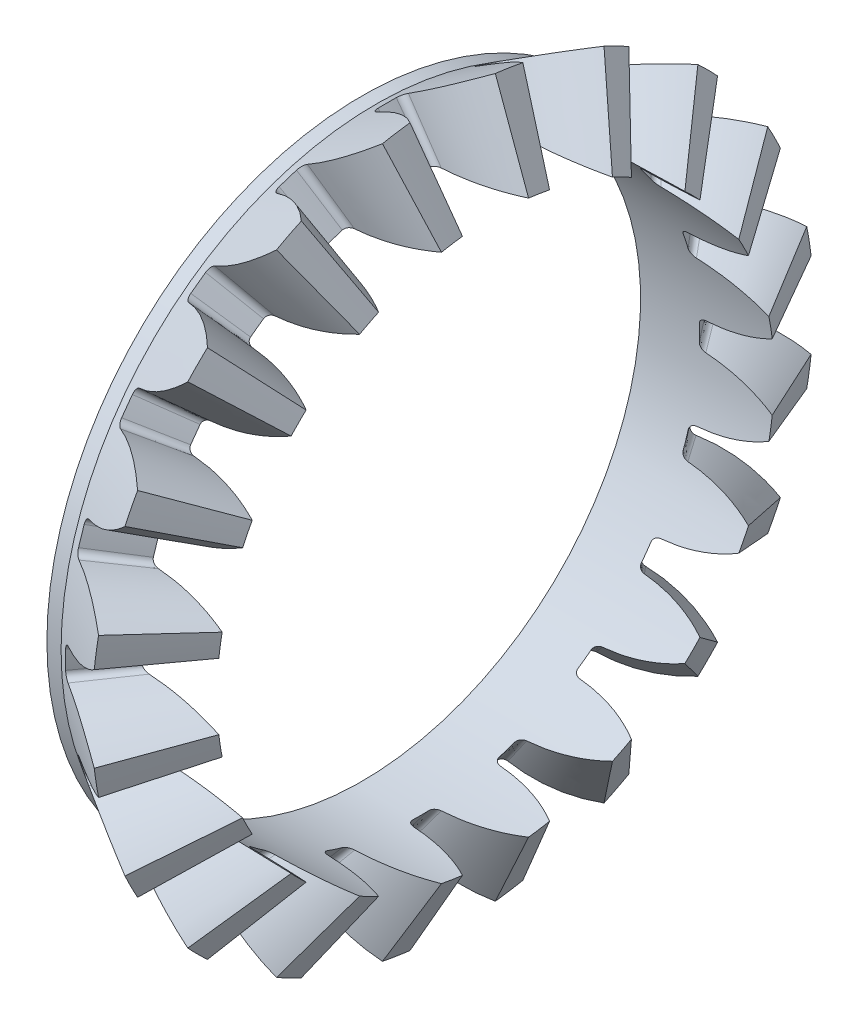
from build123d import *

# Parameters (mm, degrees)
TEETHCUTS_COUNT = 20
TEETHCUTS_ANGLE = 342
HUBSKE_R        = 2.261016722
HUB_DEPTH       = 0.101796136
BORSKE_R        = 2
BORE_DEPTH      = 2.0000508


with BuildPart() as part:
    # BasProSke → Base-Revolve (revolve)
    with BuildSketch(Plane(origin=(0, 0, 0), x_dir=(1, 0, 0), z_dir=(0, 1, 0)), mode=Mode.PRIVATE) as base_revolve_sk:
        Polygon((0, 0), (0, 2.261016722), (0.549567216, 2.590757051), (1.763431637, 0.259075703), (1.708474915, 0.226101671), (1.708474915, 0), align=None)
    revolve(base_revolve_sk.sketch.rotate(Axis((-10, 0, 0), (1, 0, 0)), 180), axis=Axis((-10, 0, 0), (1, 0, 0)))

    # ToothCut: read off the stored shape, not the designer's step
    # ToothCut: loft between two sections, ruled curve by curve
    toothcut_from = [
        Edge.make_bspline([(1.906326517, 0.004812632, -0.008590182), (1.901185085, 0.001727772, -0.015119264), (1.893603342, -0.002821273, -0.014484478), (1.889314418, -0.005394628, -0.007165832)], [0, 0, 0, 0, 1, 1, 1, 1], 3, [1, 0.747941435, 0.747941435, 1]),
        Edge.make_bspline([(1.889314418, -0.005394628, 0.007165832), (1.893603342, -0.002821273, 0.014484478), (1.901185085, 0.001727772, 0.015119264), (1.906326517, 0.004812632, 0.008590182)], [0, 0, 0, 0, 1, 1, 1, 1], 3, [1, 0.747941435, 0.747941435, 1]),
        Edge.make_bspline([(1.889314418, -0.005394628, -0.007165832), (1.888700948, -0.00576271, -0.006119003), (1.888227727, -0.006046642, -0.004977458), (1.88790527, -0.006240116, -0.003766562)], [0, 0, 0, 0, 1, 1, 1, 1], 3, [1, 0.992593456, 0.992593456, 1]),
        Edge.make_bspline([(1.88790527, -0.006240116, 0.003766562), (1.888227727, -0.006046642, 0.004977458), (1.888700948, -0.00576271, 0.006119003), (1.889314418, -0.005394628, 0.007165832)], [0, 0, 0, 0, 1, 1, 1, 1], 3, [1, 0.992593456, 0.992593456, 1]),
        Edge.make_bspline([(1.88790527, -0.006240116, -0.003766562), (1.887246928, -0.006635122, -0.001294344), (1.887246928, -0.006635122, 0.001294344), (1.88790527, -0.006240116, 0.003766562)], [0, 0, 0, 0, 1, 1, 1, 1], 3, [1, 0.970005404, 0.970005404, 1]),
        Edge.make_line((1.906326517, 0.004812632, 0.008590182), (1.906326517, 0.004812632, -0.008590182)),
    ]
    toothcut_to = [
        Edge.make_bspline([(0.577253369, 2.607368742, -0.339882132), (0.445058055, 2.528051555, -0.212107702), (0.286655489, 2.433010015, -0.134849338), (0.115818186, 2.330507633, -0.114824367)], [0, 0, 0, 0, 1, 1, 1, 1], 3, [1, 0.971017904, 0.971017904, 1]),
        Edge.make_bspline([(0.115818186, 2.330507633, 0.114824367), (0.286655489, 2.433010015, 0.134849338), (0.445058055, 2.528051555, 0.212107702), (0.577253369, 2.607368742, 0.339882132)], [0, 0, 0, 0, 1, 1, 1, 1], 3, [1, 0.971017904, 0.971017904, 1]),
        Edge.make_bspline([(0.115818186, 2.330507633, -0.114824367), (0.093127334, 2.316893123, -0.112164622), (0.078091654, 2.307871714, -0.092168463), (0.078794387, 2.308293354, -0.065585908)], [0, 0, 0, 0, 1, 1, 1, 1], 3, [1, 0.820798626, 0.820798626, 1]),
        Edge.make_bspline([(0.078794387, 2.308293354, 0.065585908), (0.078091654, 2.307871714, 0.092168463), (0.093127334, 2.316893123, 0.112164622), (0.115818186, 2.330507633, 0.114824367)], [0, 0, 0, 0, 1, 1, 1, 1], 3, [1, 0.820798626, 0.820798626, 1]),
        Edge.make_bspline([(0.078794387, 2.308293354, -0.065585908), (0.079950086, 2.308986774, -0.021868893), (0.079950086, 2.308986774, 0.021868893), (0.078794387, 2.308293354, 0.065585908)], [0, 0, 0, 0, 1, 1, 1, 1], 3, [1, 0.999683411, 0.999683411, 1]),
        Edge.make_line((0.577253369, 2.607368742, 0.339882132), (0.577253369, 2.607368742, -0.339882132)),
    ]
    toothcut = Solid(Shell([*[Face.make_surface_from_curves(toothcut_from[k], toothcut_to[k]) for k in range(6)], Face(Wire(toothcut_from)), Face(Wire(toothcut_to))]))
    add(toothcut, mode=Mode.SUBTRACT)

    # TeethCuts: ToothCut ×20 about axis
    teethcuts_axis = Axis((-10, 0, 0), (1, 0, 0))
    for i in range(1, TEETHCUTS_COUNT):
        add(toothcut.rotate(teethcuts_axis, i * TEETHCUTS_ANGLE / (TEETHCUTS_COUNT - 1)), mode=Mode.SUBTRACT)

    # HubSke → Hub (add)
    with BuildSketch(Plane.ZY):
        Circle(HUBSKE_R)
    extrude(amount=HUB_DEPTH)

    # BorSke → Bore (cut, symmetric)
    with BuildSketch(Plane(origin=(0, 0, 0), x_dir=(0, 0, -1), z_dir=(1, 0, 0))):
        with Locations(Location((0, 0, 0), (0, 0, 180))):
            Circle(BORSKE_R)
    extrude(amount=BORE_DEPTH, both=True, mode=Mode.SUBTRACT)


solid = part.part
